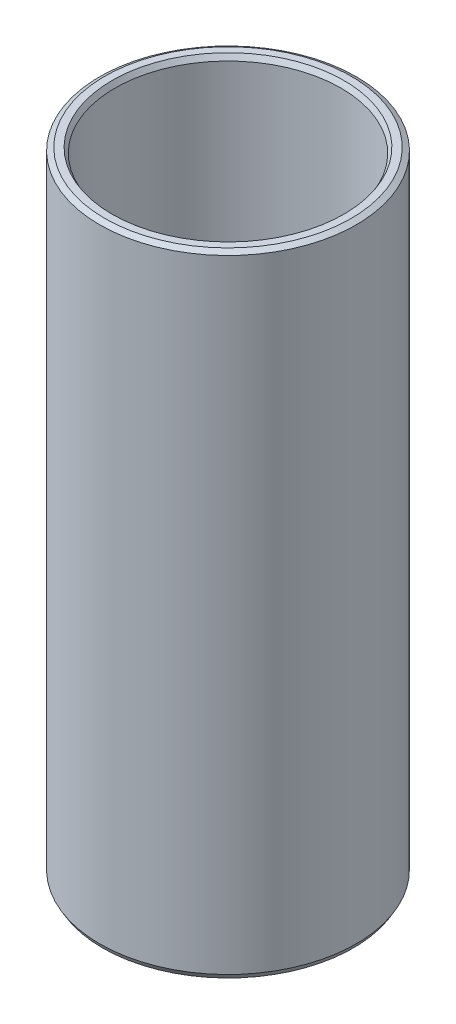
from build123d import *
from OCP.BRepFilletAPI import BRepFilletAPI_MakeChamfer

# Parameters (mm, degrees)
SKETCH1_R           = 47.5
BOSS_EXTRUDE1_DEPTH = 233.491166793
SKETCH2_R           = 41.816446768
CUT_EXTRUDE1_DEPTH  = 243.962188355
CHAMFER1_SIZE       = 1.093800791
CHAMFER1_SIZE2      = 1.894518543


with BuildPart() as part:
    # Sketch1 → Boss-Extrude1 (new body)
    with BuildSketch(Plane(origin=(0, 0, 0), x_dir=(1, 0, 0), z_dir=(0, 1, 0))):
        Circle(SKETCH1_R)
    extrude(amount=BOSS_EXTRUDE1_DEPTH)

    # Sketch2 → Cut-Extrude1 (cut, through all)
    with BuildSketch(Plane(origin=(0, 0, 0), x_dir=(1, 0, 0), z_dir=(0, 1, 0))):
        Circle(SKETCH2_R)
    extrude(amount=CUT_EXTRUDE1_DEPTH, mode=Mode.SUBTRACT)

    # Chamfer1: one chamfer whose edges measure the first distance from different faces: ONE call of the kernel's chamfer builder (chamfer() names one face for all edges)
    chamfer1_edges_1 = [part.edges().sort_by_distance(p)[0] for p in [
        (-41.816446768, 233.491166793, 0),
    ]]
    chamfer1_side_1 = [part.faces().sort_by_distance(p)[0] for p in [
        (-46.156497116, 233.491166793, 0),
    ]]
    chamfer1_edges_2 = [part.edges().sort_by_distance(p)[0] for p in [
        (-41.816446768, 0, 0),
    ]]
    chamfer1_side_2 = [part.faces().sort_by_distance(p)[0] for p in [
        (-41.816446768, 116.745583396, 0),
    ]]
    chamfer1_edges_3 = [part.edges().sort_by_distance(p)[0] for p in [
        (-47.5, 0, 0),
    ]]
    chamfer1_side_3 = [part.faces().sort_by_distance(p)[0] for p in [
        (-46.156497116, 0, 0),
    ]]
    chamfer1_edges_4 = [part.edges().sort_by_distance(p)[0] for p in [
        (-47.5, 233.491166793, 0),
    ]]
    chamfer1_side_4 = [part.faces().sort_by_distance(p)[0] for p in [
        (-47.5, 116.745583396, 0),
    ]]
    chamfer1 = BRepFilletAPI_MakeChamfer(part.part.solid().wrapped)
    for e in chamfer1_edges_1:
        chamfer1.Add(CHAMFER1_SIZE, CHAMFER1_SIZE2, e.wrapped, chamfer1_side_1[0].wrapped)  # the first distance lies on this face
    for e in chamfer1_edges_2:
        chamfer1.Add(CHAMFER1_SIZE, CHAMFER1_SIZE2, e.wrapped, chamfer1_side_2[0].wrapped)  # the first distance lies on this face
    for e in chamfer1_edges_3:
        chamfer1.Add(CHAMFER1_SIZE, CHAMFER1_SIZE2, e.wrapped, chamfer1_side_3[0].wrapped)  # the first distance lies on this face
    for e in chamfer1_edges_4:
        chamfer1.Add(CHAMFER1_SIZE, CHAMFER1_SIZE2, e.wrapped, chamfer1_side_4[0].wrapped)  # the first distance lies on this face
    add(Compound.cast(chamfer1.Shape()), mode=Mode.REPLACE)


solid = part.part
